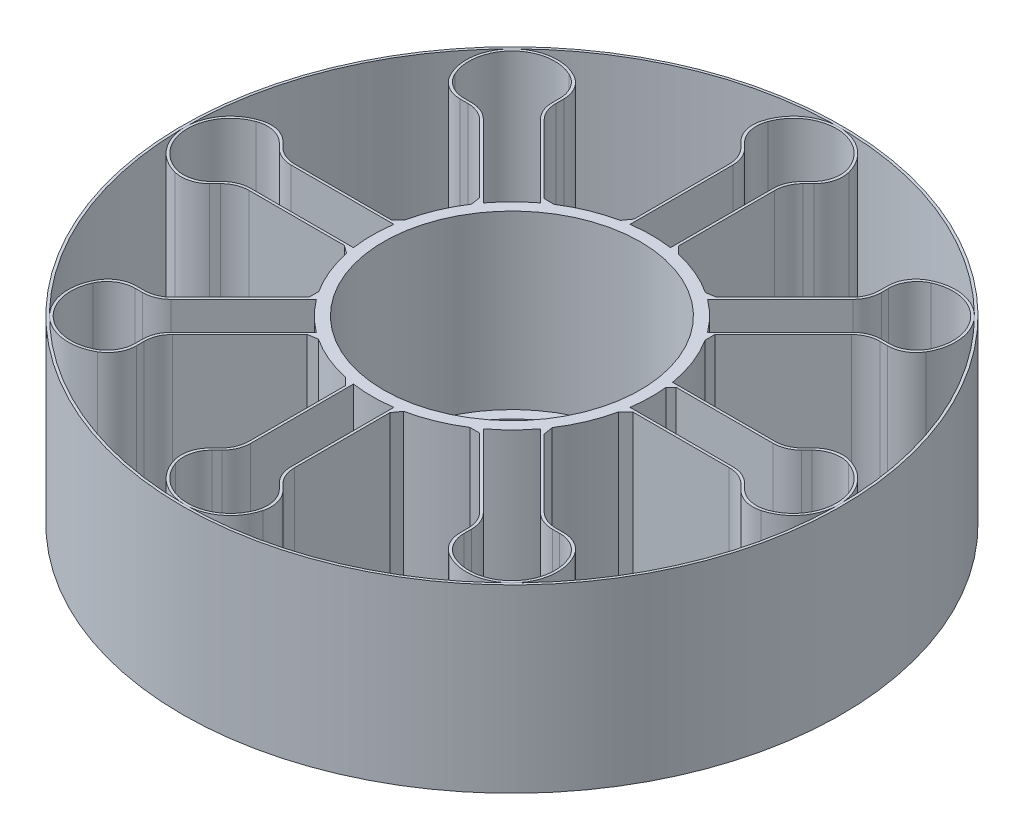
from build123d import *

# Parameters (mm, degrees)
BOSS_EXTRUDE1_START      = -31.7
BOSS_EXTRUDE1_DEPTH      = 31.7
FILLET1_R                = 5
CIRPATTERN1_COUNT        = 8
FILLET1_OF_CIRPATTERN1_R = 5
CHAMFER1_SIZE            = 1.21402778
CHAMFER1_SIZE_2          = 1


with BuildPart() as part:
    # Sketch1 → Revolve3 (revolve)
    with BuildSketch(Plane.XY, mode=Mode.PRIVATE) as revolve3_sk:
        Polygon((20.549999999999997, -14.349999999999998), (22.55, -14.349999999999998), (22.55, 15.85), (24.549999999999997, 15.85), (24.55, -15.850000000000007), (20.549999999999997, -15.85), align=None)
    revolve(revolve3_sk.sketch.rotate(Axis((0, 7.386030369518546, 0), (0, -1, 0)), 90), axis=Axis((0, 7.386030369518546, 0), (0, -1, 0)))

    # Sketch2 → Boss-Extrude1 (add)
    with BuildSketch(Plane(origin=(0, 15.85, 0), x_dir=(1, 0, 0), z_dir=(0, 1, 0)).offset(BOSS_EXTRUDE1_START)):
        with BuildLine():
            Line((-4.000000000000003, 44.22194253151468), (-3.9999999999999973, 24.221942531514685))
            ThreePointArc((-3.999999999999998, 24.221942531514692), (-3.7751623939978978, 24.25800174991634), (-3.549999999999998, 24.291973983190417))
            Line((-3.5499999999999976, 24.291973983190417), (-3.5499999999999976, 24.746666442169538))
            Line((-3.5499999999999976, 24.746666442169538), (-3.5500000000000003, 44.40833863458257))
            Line((-3.5500000000000003, 44.40833863458257), (-7.467564834110897, 48.325903468693426))
            ThreePointArc((-7.467564834110901, 48.325903468693426), (-2.065e-14, 56.98854691937759), (7.46756483411088, 48.32590346869344))
            Line((7.467564834110883, 48.32590346869344), (3.5500000000000003, 44.40833863458257))
            Line((3.5500000000000003, 44.40833863458257), (3.550000000000003, 24.746666442169534))
            Line((3.550000000000003, 24.746666442169534), (3.550000000000002, 24.291973983190417))
            ThreePointArc((3.5500000000000034, 24.291973983190424), (3.7751623939979035, 24.25800174991634), (4.0000000000000036, 24.221942531514692))
            Line((4.000000000000002, 24.221942531514685), (4.000000000000003, 44.22194253151468))
            Line((4.000000000000003, 44.22194253151468), (7.889087296526024, 48.111029828040685))
            ThreePointArc((7.88908729652602, 48.111029828040685), (-1.998e-14, 57.43854691937759), (-7.88908729652604, 48.11102982804067))
            Line((-7.889087296526036, 48.11102982804067), (-4.000000000000003, 44.22194253151468))
        make_face()
    boss_extrude1 = extrude(amount=BOSS_EXTRUDE1_DEPTH)

    # Fillet1
    fillet1_edges = [part.edges().sort_by_distance(p)[0] for p in [
        (-7.467564834110901, 0, -48.325903468693426),
        (-3.5500000000000003, 0, -44.40833863458257),
        (-4.000000000000003, 0, -44.22194253151468),
        (-7.889087296526041, 0, -48.11102982804067),
        (7.889087296526021, 0, -48.111029828040685),
        (4.000000000000003, 0, -44.22194253151468),
        (3.5500000000000003, 0, -44.40833863458257),
        (7.46756483411088, 0, -48.32590346869344),
    ]]
    fillet(fillet1_edges, radius=FILLET1_R)

    # CirPattern1: Boss-Extrude1 ×8 about axis
    cirpattern1_axis = Axis((-2.727e-14, 0, 9.9e-16), (0, 1, 0))
    for i in range(1, CIRPATTERN1_COUNT):
        add(boss_extrude1.rotate(cirpattern1_axis, i * 360 / CIRPATTERN1_COUNT))

    # Fillet1 of CirPattern1
    fillet1_of_cirpattern1_edges = [part.edges().sort_by_distance(p)[0] for p in [
        (-39.45193978282964, 0, -28.891208316529625),
        (-33.91166646295413, 0, -28.891208316529656),
        (-34.09806256602203, 0, -28.441208316529657),
        (-39.59806256602203, 0, -28.441208316529625),
        (-28.441208316529632, 0, -39.59806256602205),
        (-28.441208316529643, 0, -34.098062566022044),
        (-28.891208316529642, 0, -33.911666462954145),
        (-28.891208316529635, 0, -39.451939782829655),
        (-48.325903468693454, 0, 7.467564834110871),
        (-44.4083386345826, 0, 3.5499999999999714),
        (-44.221942531514706, 0, 3.999999999999974),
        (-48.1110298280407, 0, 7.889087296526012),
        (-48.111029828040714, 0, -7.88908729652605),
        (-44.221942531514706, 0, -4.000000000000032),
        (-44.4083386345826, 0, -3.550000000000029),
        (-48.32590346869347, 0, -7.4675648341109095),
        (-28.891208316529653, 0, 39.45193978282962),
        (-28.891208316529685, 0, 33.91166646295411),
        (-28.441208316529686, 0, 34.09806256602201),
        (-28.441208316529654, 0, 39.59806256602201),
        (-39.59806256602208, 0, 28.441208316529607),
        (-34.09806256602207, 0, 28.441208316529618),
        (-33.91166646295417, 0, 28.891208316529617),
        (-39.45193978282968, 0, 28.89120831652961),
        (7.46756483411084, 0, 48.325903468693426),
        (3.5499999999999403, 0, 44.40833863458257),
        (3.9999999999999427, 0, 44.22194253151468),
        (7.889087296525981, 0, 48.11102982804067),
        (-7.889087296526081, 0, 48.111029828040685),
        (-4.000000000000062, 0, 44.22194253151468),
        (-3.55000000000006, 0, 44.40833863458257),
        (-7.467564834110941, 0, 48.32590346869344),
        (39.45193978282959, 0, 28.891208316529635),
        (33.91166646295408, 0, 28.891208316529667),
        (34.09806256602198, 0, 28.441208316529664),
        (39.59806256602198, 0, 28.441208316529636),
        (28.44120831652958, 0, 39.59806256602205),
        (28.44120831652959, 0, 34.098062566022044),
        (28.89120831652959, 0, 33.91166646295415),
        (28.891208316529582, 0, 39.45193978282966),
        (48.3259034686934, 0, -7.467564834110863),
        (44.40833863458254, 0, -3.549999999999964),
        (44.22194253151465, 0, -3.9999999999999662),
        (48.11102982804064, 0, -7.889087296526004),
        (48.11102982804066, 0, 7.889087296526058),
        (44.22194253151465, 0, 4.000000000000039),
        (44.40833863458254, 0, 3.5500000000000367),
        (48.32590346869341, 0, 7.4675648341109175),
        (28.891208316529607, 0, -39.451939782829605),
        (28.89120831652964, 0, -33.9116664629541),
        (28.441208316529636, 0, -34.098062566021994),
        (28.441208316529607, 0, -39.598062566022),
        (39.598062566022016, 0, -28.441208316529597),
        (34.098062566022016, 0, -28.441208316529607),
        (33.91166646295412, 0, -28.89120831652961),
        (39.45193978282963, 0, -28.8912083165296),
    ]]
    fillet(fillet1_of_cirpattern1_edges, radius=FILLET1_OF_CIRPATTERN1_R)

    # Chamfer1
    # the kernel refuses this chamfer: 1.21402778, 1, 0.881762192 mm, written as the material it adds along each edge
    with BuildSketch(Plane(origin=(-19.95592694229108, -15.85, -14.299072692798719), x_dir=(-0.7071067811865505, 0, -0.7071067811865447), z_dir=(0, 1, 0))) as chamfer1_piece_1:
        with BuildLine():
            Line((CHAMFER1_SIZE, 5e-17), (-0.1873618395733286, 1.0041413811521018))
            ThreePointArc((-0.1873618395733286, 1.0041413811521018), (-0.09168091628271141, 0.5202847676292985), (0, 0))
            Line((0, 0), (CHAMFER1_SIZE, 5e-17))
        make_face()
    extrude(amount=31.7)
    with BuildSketch(Plane(origin=(-14.299072692798704, -15.85, -19.9559269422911), x_dir=(-0.7071067811865493, 0, -0.7071067811865458), z_dir=(0, 1, 0))) as chamfer1_piece_2:
        with BuildLine():
            Line((CHAMFER1_SIZE_2, 3e-17), (-0.23703032977889585, -1.2370303297788952))
            ThreePointArc((-0.23703032977889585, -1.2370303297788952), (-0.11437339830728317, -0.6397856079375166), (0, 0))
            Line((0, 0), (CHAMFER1_SIZE_2, 3e-17))
        make_face()
    extrude(amount=31.7)
    with BuildSketch(Plane(origin=(-24.221942531514717, -15.85, 3.9999999999999685), x_dir=(-1, 0, 0), z_dir=(0, 1, 0))) as chamfer1_piece_3:
        with BuildLine():
            Line((CHAMFER1_SIZE, 0), (-0.18736183957333807, 1.0041413811521047))
            ThreePointArc((-0.18736183957333807, 1.0041413811521047), (-0.09168091628272279, 0.5202847676293048), (0, 0))
            Line((0, 0), (CHAMFER1_SIZE, 0))
        make_face()
    extrude(amount=31.7)
    with BuildSketch(Plane(origin=(-24.22194253151472, -15.85, -4.000000000000032), x_dir=(0.1881888194045618, 0, -0.9821328669030057), z_dir=(0, 1, 0))) as chamfer1_piece_4:
        with BuildLine():
            Line((1.2595346021559053, 1e-17), (-CHAMFER1_SIZE_2 * 0.188188819405, CHAMFER1_SIZE_2 * 0.982132866903))
            Line((-CHAMFER1_SIZE_2 * 0.188188819405, CHAMFER1_SIZE_2 * 0.982132866903), (0, 0))
            ThreePointArc((0, 0), (0.6498782681257044, 0.00807062465280822), (1.2595346021559053, 1e-17))
        make_face()
    extrude(amount=31.7)
    with BuildSketch(Plane(origin=(-14.299072692798747, -15.85, 19.955926942291054), x_dir=(-0.7071067811865438, 0, 0.7071067811865511), z_dir=(0, 1, 0))) as chamfer1_piece_5:
        with BuildLine():
            Line((CHAMFER1_SIZE, -1e-17), (-0.18736183957332117, 1.0041413811520956))
            ThreePointArc((-0.18736183957332117, 1.0041413811520956), (-0.09168091628270707, 0.5202847676292998), (0, 0))
            Line((0, 0), (CHAMFER1_SIZE, -1e-17))
        make_face()
    extrude(amount=31.7)
    with BuildSketch(Plane(origin=(-19.95592694229113, -15.85, 14.299072692798678), x_dir=(-0.5614032198688502, 0, -0.8275424005577523), z_dir=(0, 1, 0))) as chamfer1_piece_6:
        with BuildLine():
            Line((1.2595346021558995, 2e-17), (-CHAMFER1_SIZE_2 * 0.188188819405, CHAMFER1_SIZE_2 * 0.982132866903))
            Line((-CHAMFER1_SIZE_2 * 0.188188819405, CHAMFER1_SIZE_2 * 0.982132866903), (0, 0))
            ThreePointArc((0, 0), (0.6498782681257047, 0.00807062465281147), (1.2595346021558995, 2e-17))
        make_face()
    extrude(amount=31.7)
    with BuildSketch(Plane(origin=(3.9999999999999396, -15.85, 24.221942531514692), x_dir=(3.7e-16, 0, 1), z_dir=(0, 1, 0))) as chamfer1_piece_7:
        with BuildLine():
            Line((CHAMFER1_SIZE, 0), (-0.18736183957330219, 1.0041413811520794))
            ThreePointArc((-0.18736183957330219, 1.0041413811520794), (-0.09168091628269062, 0.5202847676293061), (0, 0))
            Line((0, 0), (CHAMFER1_SIZE, 0))
        make_face()
    extrude(amount=31.7)
    with BuildSketch(Plane(origin=(-4.0000000000000595, -15.85, 24.221942531514696), x_dir=(-0.9821328669030087, 0, -0.18818881940454613), z_dir=(0, 1, 0))) as chamfer1_piece_8:
        with BuildLine():
            Line((1.2595346021558778, 0), (-CHAMFER1_SIZE_2 * 0.188188819405, CHAMFER1_SIZE_2 * 0.982132866903))
            Line((-CHAMFER1_SIZE_2 * 0.188188819405, CHAMFER1_SIZE_2 * 0.982132866903), (0, 0))
            ThreePointArc((0, 0), (0.6498782681256918, 0.00807062465281711), (1.2595346021558778, 0))
        make_face()
    extrude(amount=31.7)
    with BuildSketch(Plane(origin=(-3.9999999999999973, -15.85, -24.22194253151469), x_dir=(-0.9830339996769397, 0, 0.18342343219762958), z_dir=(0, 1, 0))) as chamfer1_piece_9:
        with BuildLine():
            Line((1.0214716698324573, -1e-17), (-CHAMFER1_SIZE * 0.183423432206, -CHAMFER1_SIZE * 0.983033999724))
            Line((-CHAMFER1_SIZE * 0.183423432206, -CHAMFER1_SIZE * 0.983033999724), (0, 0))
            ThreePointArc((0, 0), (0.5282740444252132, -0.00530695997128862), (1.0214716698324573, -1e-17))
        make_face()
    extrude(amount=31.7)
    with BuildSketch(Plane(origin=(19.955926942291025, -15.85, 14.299072692798724), x_dir=(0.5654100545730647, 0, -0.8248099600439389), z_dir=(0, 1, 0))) as chamfer1_piece_10:
        with BuildLine():
            Line((1.0214716698324426, -1e-17), (-CHAMFER1_SIZE * 0.183423432206, -CHAMFER1_SIZE * 0.983033999724))
            Line((-CHAMFER1_SIZE * 0.183423432206, -CHAMFER1_SIZE * 0.983033999724), (0, 0))
            ThreePointArc((0, 0), (0.5282740444252078, -0.00530695997129553), (1.0214716698324426, -1e-17))
        make_face()
    extrude(amount=31.7)
    with BuildSketch(Plane(origin=(14.29907269279865, -15.85, 19.955926942291104), x_dir=(-0.8275424005577362, 0, 0.5614032198688739), z_dir=(0, 1, 0))) as chamfer1_piece_11:
        with BuildLine():
            Line((1.25953460215584, -4e-17), (-CHAMFER1_SIZE_2 * 0.188188819405, CHAMFER1_SIZE_2 * 0.982132866903))
            Line((-CHAMFER1_SIZE_2 * 0.188188819405, CHAMFER1_SIZE_2 * 0.982132866903), (0, 0))
            ThreePointArc((0, 0), (0.6498782681256742, 0.00807062465282665), (1.25953460215584, -4e-17))
        make_face()
    extrude(amount=31.7)
    with BuildSketch(Plane(origin=(4.000000000000003, -15.85, -24.221942531514692), x_dir=(-8.9e-16, 0, -1), z_dir=(0, 1, 0))) as chamfer1_piece_12:
        with BuildLine():
            Line((CHAMFER1_SIZE_2, 0), (-0.23703032977887273, -1.2370303297788803))
            ThreePointArc((-0.23703032977887273, -1.2370303297788803), (-0.11437339830726202, -0.6397856079375125), (0, 0))
            Line((0, 0), (CHAMFER1_SIZE_2, 0))
        make_face()
    extrude(amount=31.7)
    with BuildSketch(Plane(origin=(24.291973983190392, -15.85, -3.549999999999964), x_dir=(1, 0, 4.4e-16), z_dir=(0, 1, 0))) as chamfer1_piece_13:
        with BuildLine():
            Line((CHAMFER1_SIZE_2, 0), (0.11315102412519135, -0.8868489758746905))
            ThreePointArc((0.11315102412519135, -0.8868489758746905), (0.06216005619028684, -0.4550597434070611), (0, 0))
            Line((0, 0), (CHAMFER1_SIZE_2, 0))
        make_face()
    extrude(amount=31.7)
    with BuildSketch(Plane(origin=(24.221942531514667, -15.85, 4.000000000000036), x_dir=(1, 0, -8.9e-16), z_dir=(0, 1, 0))) as chamfer1_piece_14:
        with BuildLine():
            Line((CHAMFER1_SIZE_2, 0), (-0.23703032977884786, -1.2370303297788554))
            ThreePointArc((-0.23703032977884786, -1.2370303297788554), (-0.1143733983072407, -0.6397856079374983), (0, 0))
            Line((0, 0), (CHAMFER1_SIZE_2, 0))
        make_face()
    extrude(amount=31.7)
    with BuildSketch(Plane(origin=(14.299072692798696, -15.85, -19.955926942291047), x_dir=(-0.8248099600439398, 0, -0.5654100545730633), z_dir=(0, 1, 0))) as chamfer1_piece_15:
        with BuildLine():
            Line((1.0214716698324264, 1e-17), (-CHAMFER1_SIZE * 0.183423432206, -CHAMFER1_SIZE * 0.983033999724))
            Line((-CHAMFER1_SIZE * 0.183423432206, -CHAMFER1_SIZE * 0.983033999724), (0, 0))
            ThreePointArc((0, 0), (0.5282740444251914, -0.00530695997129465), (1.0214716698324264, 1e-17))
        make_face()
    extrude(amount=31.7)
    with BuildSketch(Plane(origin=(19.955926942291075, -15.85, -14.299072692798672), x_dir=(0.7071067811865476, 0, -0.7071067811865476), z_dir=(0, 1, 0))) as chamfer1_piece_16:
        with BuildLine():
            Line((CHAMFER1_SIZE_2, -1e-17), (-0.23703032977883995, -1.237030329778838))
            ThreePointArc((-0.23703032977883995, -1.237030329778838), (-0.11437339830723259, -0.639785607937478), (0, 0))
            Line((0, 0), (CHAMFER1_SIZE_2, -1e-17))
        make_face()
    extrude(amount=31.7)


with BuildPart() as body_2:
    # Sketch3 → Revolve4 (revolve)
    with BuildSketch(Plane(origin=(0, 0, 0), x_dir=(0, 0, -1), z_dir=(1, 0, 0)), mode=Mode.PRIVATE) as revolve4_sk:
        Polygon((57.43854691937759, 15.850000000000003), (57.43854691937759, -15.850000000000003), (57.8885469193776, -15.850000000000003), (57.888546919377596, 15.850000000000003), align=None)
    revolve(revolve4_sk.sketch.rotate(Axis((0, 24.96515184483566, 0), (0, -1, 0)), 180), axis=Axis((0, 24.96515184483566, 0), (0, -1, 0)))


solid = Compound([part.part, body_2.part])
